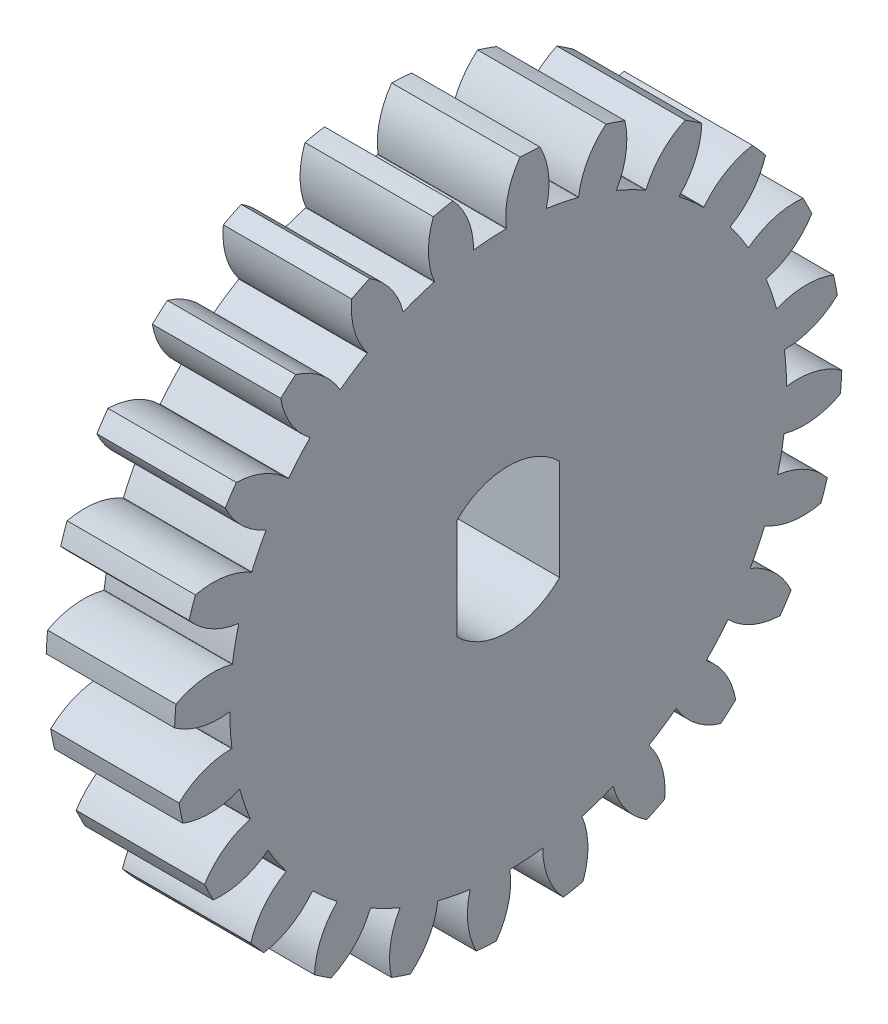
from build123d import *

# Parameters (mm, degrees)
SKETCH2_R                = 10.843
BOSS_EXTRUDE1_DEPTH      = 2.5
BOSS_EXTRUDE3_DEPTH      = 2.5
SKETCH5_R                = 38.4
SKETCH5_R_2              = 13
CUT_EXTRUDE1_DEPTH       = 18.467999614
FILLET1_R                = 0.01
CIRPATTERN2_COUNT        = 24
FILLET1_OF_CIRPATTERN2_R = 0.01
CUT_EXTRUDE2_DEPTH       = 20.041320582


with BuildPart() as part:
    # Sketch2 → Boss-Extrude1 (new, symmetric)
    with BuildSketch(Plane(origin=(0, 0, 0), x_dir=(0, 0, -1), z_dir=(1, 0, 0))):
        Circle(SKETCH2_R)
    extrude(amount=BOSS_EXTRUDE1_DEPTH, both=True)

    # Sketch4 → Boss-Extrude3 (add, symmetric)
    with BuildSketch(Plane(origin=(0, 0, 0), x_dir=(0, 0, -1), z_dir=(1, 0, 0))):
        with BuildLine():
            ThreePointArc((0.882552794, 13.465153601), (-0.089134073, 11.445068509), (0.610565863, 9.315434938))
            ThreePointArc((0.610565863, 9.315434938), (1.58225273, 11.33552003), (0.882552794, 13.465153601))
        make_face()
    boss_extrude3 = extrude(amount=BOSS_EXTRUDE3_DEPTH, both=True)

    # Sketch5 → Cut-Extrude1 (cut, symmetric)
    with BuildSketch(Plane(origin=(0, 0, 0), x_dir=(0, 0, -1), z_dir=(1, 0, 0))):
        Circle(SKETCH5_R)
        Circle(SKETCH5_R_2, mode=Mode.SUBTRACT)
    cut_extrude1 = extrude(amount=CUT_EXTRUDE1_DEPTH, both=True, mode=Mode.SUBTRACT)

    # Fillet1
    fillet1_edges = [part.edges().sort_by_distance(p)[0] for p in [
        (0, 10.8427871, 0.067947841),
        (0, 10.74115658, -1.482634251),
    ]]
    fillet(fillet1_edges, radius=FILLET1_R)

    # CirPattern2: Boss-Extrude3, Cut-Extrude1 ×24 about axis
    cirpattern2_axis = Axis((2.5, 0, 0), (1, 0, 0))
    add([boss_extrude3.rotate(cirpattern2_axis, i * 360 / CIRPATTERN2_COUNT) for i in range(1, CIRPATTERN2_COUNT)])
    add([cut_extrude1.rotate(cirpattern2_axis, i * 360 / CIRPATTERN2_COUNT) for i in range(1, CIRPATTERN2_COUNT)], mode=Mode.SUBTRACT)

    # Fillet1 of CirPattern2
    fillet1_of_cirpattern2_edges = [part.edges().sort_by_distance(p)[0] for p in [
        (0, 10.455741893, 2.871952378),
        (0, 10.758894526, 1.347901175),
        (0, 9.356155156, 5.480238107),
        (0, 10.04343159, 4.086579364),
        (0, 7.618961906, 7.715054665),
        (0, 8.643525389, 6.546763922),
        (0, 5.362548993, 9.424102997),
        (0, 6.654577216, 8.560797339),
        (0, 2.740687229, 10.490914284),
        (0, 4.212130604, 9.991426564),
        (0, -0.067947841, 10.8427871),
        (0, 1.482634251, 10.74115658),
        (0, -2.871952378, 10.455741893),
        (0, -1.347901175, 10.758894526),
        (0, -5.480238107, 9.356155156),
        (0, -4.086579364, 10.04343159),
        (0, -7.715054665, 7.618961906),
        (0, -6.546763922, 8.643525389),
        (0, -9.424102997, 5.362548993),
        (0, -8.560797339, 6.654577216),
        (0, -10.490914284, 2.740687229),
        (0, -9.991426564, 4.212130604),
        (0, -10.8427871, -0.067947841),
        (0, -10.74115658, 1.482634251),
        (0, -10.455741893, -2.871952378),
        (0, -10.758894526, -1.347901175),
        (0, -9.356155156, -5.480238107),
        (0, -10.04343159, -4.086579364),
        (0, -7.618961906, -7.715054665),
        (0, -8.643525389, -6.546763922),
        (0, -5.362548993, -9.424102997),
        (0, -6.654577216, -8.560797339),
        (0, -2.740687229, -10.490914284),
        (0, -4.212130604, -9.991426564),
        (0, 0.067947841, -10.8427871),
        (0, -1.482634251, -10.74115658),
        (0, 2.871952378, -10.455741893),
        (0, 1.347901175, -10.758894526),
        (0, 5.480238107, -9.356155156),
        (0, 4.086579364, -10.04343159),
        (0, 7.715054665, -7.618961906),
        (0, 6.546763922, -8.643525389),
        (0, 9.424102997, -5.362548993),
        (0, 8.560797339, -6.654577216),
        (0, 10.490914284, -2.740687229),
        (0, 9.991426564, -4.212130604),
    ]]
    fillet(fillet1_of_cirpattern2_edges, radius=FILLET1_OF_CIRPATTERN2_R)

    # Sketch7 → Cut-Extrude2 (cut, through all)
    with BuildSketch(Plane.ZY.offset(2.5)):
        with BuildLine():
            Line((-2, 1.959591794), (-2, -1.959591794))
            ThreePointArc((-2, -1.959591794), (0, -2.8), (2, -1.959591794))
            Line((2, -1.959591794), (2, 1.959591794))
            ThreePointArc((2, 1.959591794), (0, 2.8), (-2, 1.959591794))
        make_face()
    extrude(amount=-CUT_EXTRUDE2_DEPTH, mode=Mode.SUBTRACT)


solid = part.part
